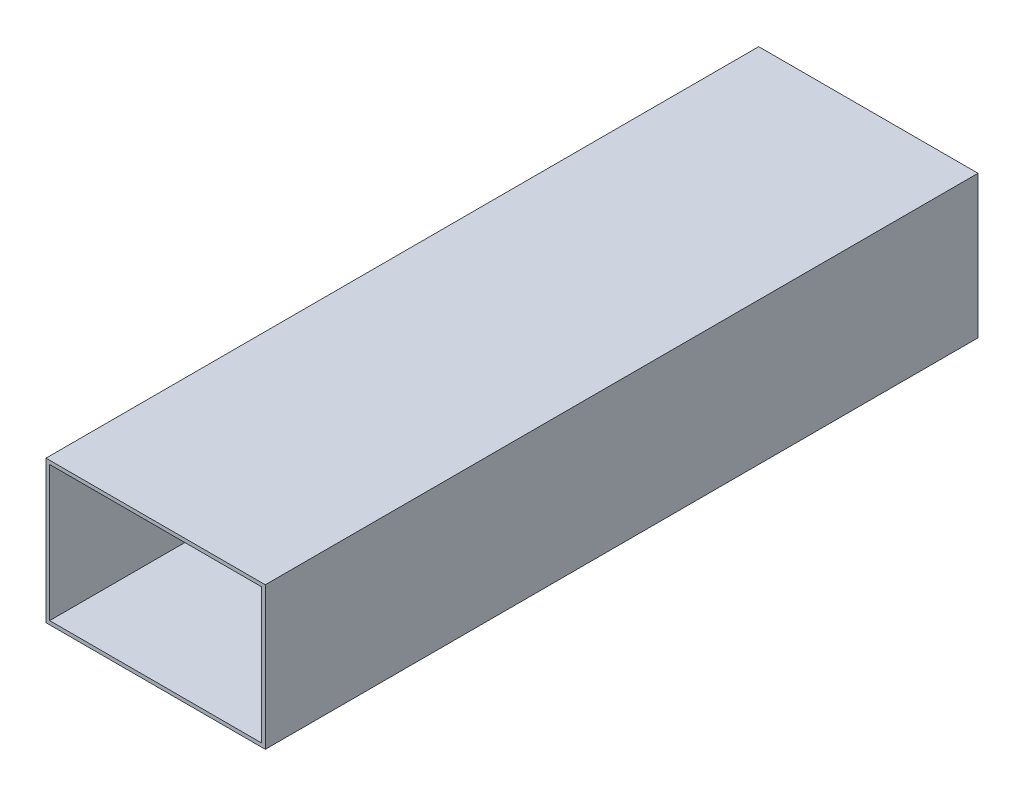
from build123d import *

# Parameters (mm, degrees)
SKETCH1_W           = 15
SKETCH1_H           = 48.75
BOSS_EXTRUDE1_DEPTH = 9.75
SHELL1_T            = -0.25


with BuildPart() as part:
    # Sketch1 → Boss-Extrude1 (new body)
    with BuildSketch(Plane(origin=(0, 0, 0), x_dir=(1, 0, 0), z_dir=(0, 1, 0))):
        with Locations((-9.0163826, -16.379710312)):
            Rectangle(SKETCH1_W, SKETCH1_H)
    extrude(amount=BOSS_EXTRUDE1_DEPTH)

    # Shell1
    shell1_openings = [part.faces().sort_by_distance(p)[0] for p in [
        (-9.0163826, 4.875, 40.754710312),
    ]]
    offset(amount=SHELL1_T, openings=shell1_openings, kind=Kind.INTERSECTION)


solid = part.part
